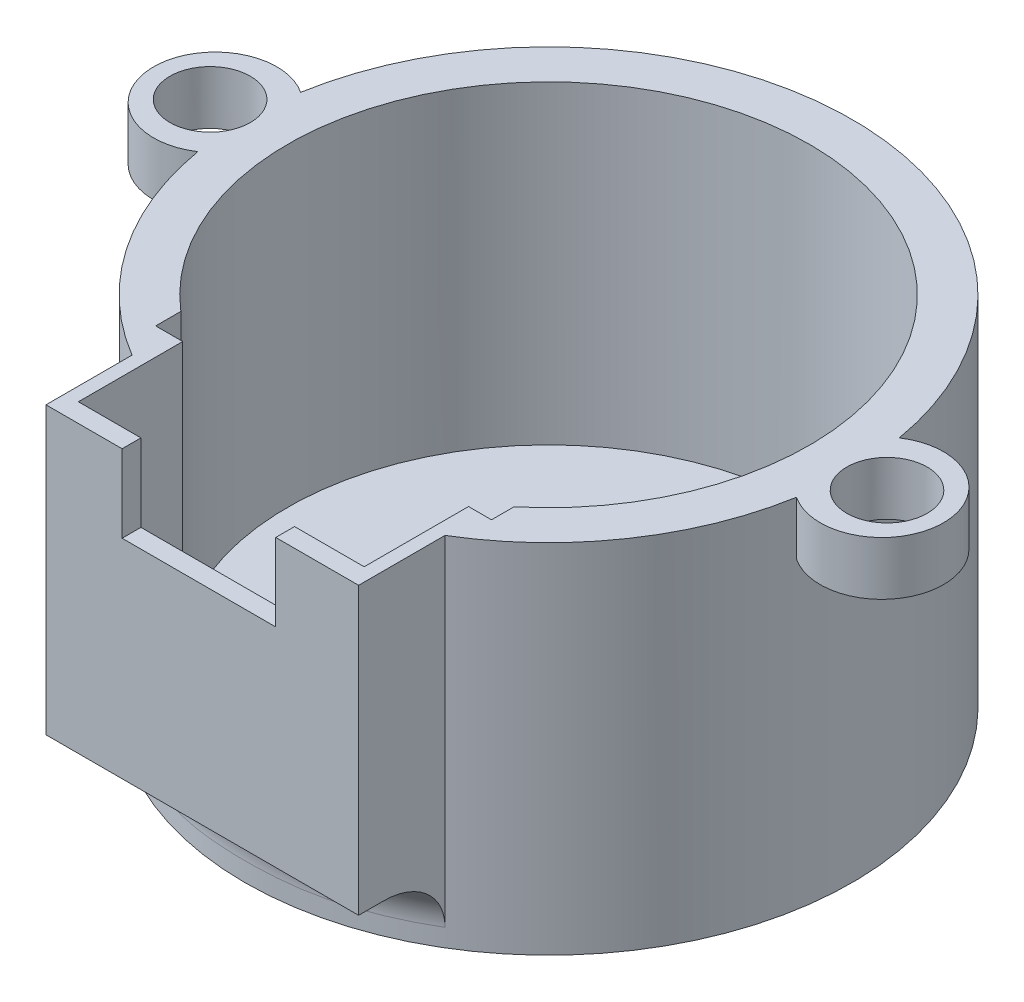
from build123d import *

# Parameters (mm, degrees)
SKETCH1_R           = 17
BOSS_EXTRUDE1_DEPTH = 20
SHELL1_T            = -2.4
SKETCH2_R           = 3.45
BOSS_EXTRUDE3_DEPTH = 3
SKETCH4_R           = 2.25
CUT_EXTRUDE1_DEPTH  = 3
SKETCH5_W           = 17.5
SKETCH5_H           = 7.7
BOSS_EXTRUDE4_DEPTH = 16
SKETCH6_W           = 16
SKETCH6_H           = 8.6
CUT_EXTRUDE2_DEPTH  = 14
SKETCH7_W           = 8.6
SKETCH7_H           = 5.8
CUT_EXTRUDE3_DEPTH  = 5
FILLET3_R           = 3
FILLET4_R           = 1
SKETCH8_W           = 18.8
SKETCH8_H           = 2.4
CUT_EXTRUDE4_DEPTH  = 16


with BuildPart() as part:
    # Sketch1 → Boss-Extrude1 (new body)
    with BuildSketch(Plane(origin=(0, 0, 0), x_dir=(1, 0, 0), z_dir=(0, 1, 0))):
        Circle(SKETCH1_R)
    extrude(amount=BOSS_EXTRUDE1_DEPTH)

    # Shell1
    shell1_openings = [part.faces().sort_by_distance(p)[0] for p in [
        (0, 20, 0),
    ]]
    offset(amount=SHELL1_T, openings=shell1_openings, kind=Kind.INTERSECTION)

    # Sketch2 → Boss-Extrude3 (add)
    with BuildSketch(Plane(origin=(0, 20, 0), x_dir=(1, 0, 0), z_dir=(0, 1, 0))):
        with Locations((18.659372003, 0)):
            Circle(SKETCH2_R)
        with Locations((-18.659372003, 0)):
            Circle(SKETCH2_R)
    extrude(amount=-BOSS_EXTRUDE3_DEPTH)

    # Sketch4 → Cut-Extrude1 (cut)
    with BuildSketch(Plane(origin=(0, 20, 0), x_dir=(1, 0, 0), z_dir=(0, 1, 0))):
        with Locations((18.946509427, 0)):
            Circle(SKETCH4_R)
        with Locations((-18.946509427, 0)):
            Circle(SKETCH4_R)
    extrude(amount=-CUT_EXTRUDE1_DEPTH, mode=Mode.SUBTRACT)

    # Sketch5 → Boss-Extrude4 (add)
    with BuildSketch(Plane(origin=(0, 20, 0), x_dir=(1, 0, 0), z_dir=(0, 1, 0))):
        with Locations((0.01757968, -15.550633972)):
            Rectangle(SKETCH5_W, SKETCH5_H)
    extrude(amount=-BOSS_EXTRUDE4_DEPTH)

    # Sketch6 → Cut-Extrude2 (cut)
    with BuildSketch(Plane(origin=(0, 20, 0), x_dir=(1, 0, 0), z_dir=(0, 1, 0))):
        with Locations((0.025977535, -14.047647825)):
            Rectangle(SKETCH6_W, SKETCH6_H)
    extrude(amount=-CUT_EXTRUDE2_DEPTH, mode=Mode.SUBTRACT)

    # Sketch7 → Cut-Extrude3 (cut)
    with BuildSketch(Plane.XY.offset(19.400633972)):
        with Locations((-0.172487463, 18.560997168)):
            Rectangle(SKETCH7_W, SKETCH7_H)
    extrude(amount=-CUT_EXTRUDE3_DEPTH, mode=Mode.SUBTRACT)

    # Fillet3
    fillet3_edges = [part.edges().sort_by_distance(p)[0] for p in [
        (0.020504274, 4, 16.999987635),
    ]]
    fillet(fillet3_edges, radius=FILLET3_R)

    # Fillet4
    fillet4_edges = [part.edges().sort_by_distance(p)[0] for p in [
        (0, 4, 11.700633972),
    ]]
    fillet(fillet4_edges, radius=FILLET4_R)

    # Sketch8 → Cut-Extrude4 (cut)
    with BuildSketch(Plane(origin=(0, 20, 0), x_dir=(1, 0, 0), z_dir=(0, 1, 0))):
        with Locations((-0.087709678, -11.305880471)):
            Rectangle(SKETCH8_W, SKETCH8_H)
    extrude(amount=-CUT_EXTRUDE4_DEPTH, mode=Mode.SUBTRACT)


solid = part.part
